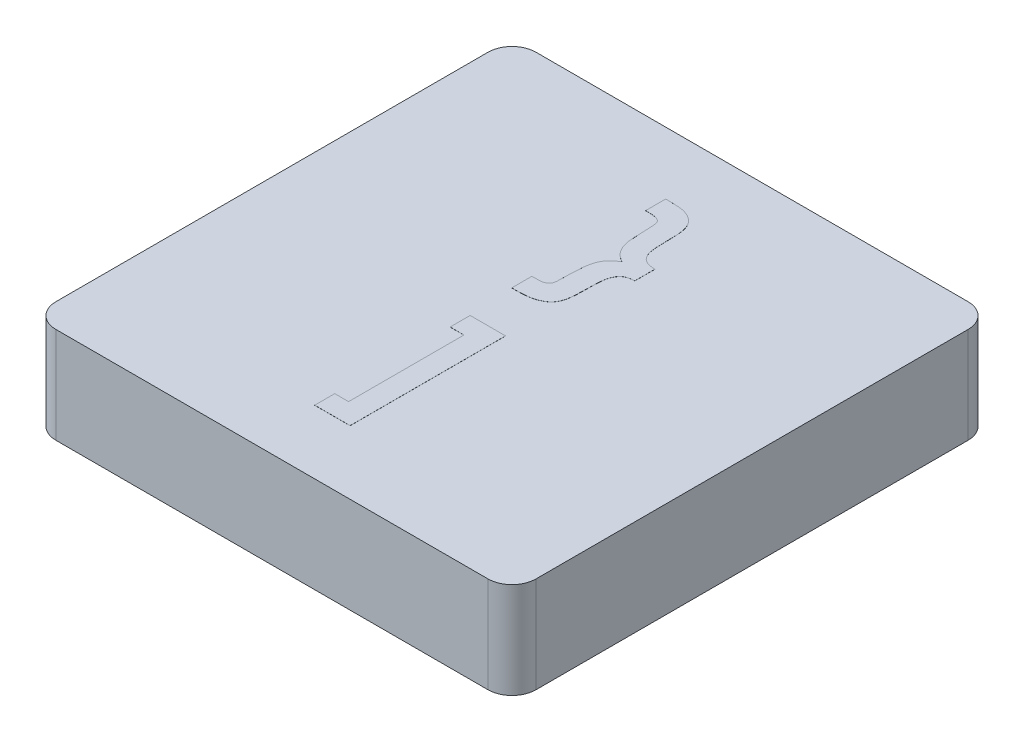
from build123d import *

# Parameters (mm, degrees)
SKETCH1_W           = 12.7
SKETCH1_H           = 12.7
BOSS_EXTRUDE1_DEPTH = 2.54
FILLET1_R           = 0.635
SHELL1_START        = 0.635
SHELL1_OUTLINE_W    = 1.905
SHELL1_OUTLINE_H    = 11.43
SHELL1_DEPTH        = 11.43
SKETCH2_R           = 2.54
BOSS_EXTRUDE2_DEPTH = 1.905
BOSS_EXTRUDE4_DEPTH = 0.00254


# Read off the part's stored shape, not the designer's step: Shell1
with BuildPart() as part:
    # Sketch1 → Boss-Extrude1 (new body)
    with BuildSketch(Plane(origin=(0, 0, 0), x_dir=(1, 0, 0), z_dir=(0, 1, 0))):
        with Locations((6.35, 6.35)):
            Rectangle(SKETCH1_W, SKETCH1_H)
    extrude(amount=BOSS_EXTRUDE1_DEPTH)

    # Fillet1
    fillet1_edges = [part.edges().sort_by_distance(p)[0] for p in [
        (0, 1.27, -12.7),
        (12.7, 1.27, -12.7),
        (12.7, 1.27, 0),
        (0, 1.27, 0),
    ]]
    fillet(fillet1_edges, radius=FILLET1_R)

    # Shell1 outline → Shell1 (cut)
    with BuildSketch(Plane.YZ.offset(SHELL1_START)):
        with Locations((0.9525, -6.35)):
            Rectangle(SHELL1_OUTLINE_W, SHELL1_OUTLINE_H)
    extrude(amount=SHELL1_DEPTH, mode=Mode.SUBTRACT)

    # Sketch2 → Boss-Extrude2 (add)
    with BuildSketch(Plane(origin=(0, 1.905, 0), x_dir=(-1, 0, 0), z_dir=(0, -1, 0))):
        with Locations(Location((-6.35, 6.35, 0), (0, 0, 270))):
            Circle(SKETCH2_R)
    extrude(amount=BOSS_EXTRUDE2_DEPTH)

    # Sketch4 → Boss-Extrude4 (add)
    with BuildSketch(Plane(origin=(0, 2.54, 0), x_dir=(1, 0, 0), z_dir=(0, 1, 0))):
        Polygon((6.732628205, 1.685192308), (5.796410256, 1.685192308), (5.796410256, 2.214358974), (6.16275641, 2.214358974), (6.16275641, 5.26724359), (5.796410256, 5.26724359), (5.796410256, 5.796410256), (6.732628205, 5.796410256), align=None)
        with BuildLine():
            Line((7.180384615, 9.298679487), (7.180384615, 8.769512821))
            add(Edge.make_bspline(
                [(7.180384615, 8.769512821), (7.152116937, 8.767117491), (7.099017873, 8.762618013), (7.0253764, 8.747759344), (6.963193844, 8.726027376), (6.911796647, 8.695840272), (6.870023551, 8.656558396), (6.833838845, 8.609026502), (6.803009788, 8.5518655), (6.781418088, 8.497365782), (6.767346169, 8.44716793), (6.757830159, 8.402799025), (6.75069662, 8.352150851), (6.743391897, 8.295819896), (6.738424945, 8.23320688), (6.735756394, 8.164671888), (6.732702366, 8.090058902), (6.732653587, 8.038308385), (6.732628205, 8.011379808)],
                knots=[0, 0, 0, 0, 1.34611932, 2.528600843, 3.557114667, 4.459936617, 5.336105306, 6.262193966, 7.284829814, 8.410061544, 9.037770113, 9.758356444, 10.562659162, 11.465312764, 12.455021506, 13.543269222, 14.721630887, 16, 16, 16, 16], degree=3))
            add(Edge.make_bspline(
                [(6.732628205, 8.011379808), (6.7325086, 7.977670399), (6.732279147, 7.913001774), (6.730484256, 7.820124139), (6.727043054, 7.73576107), (6.723840889, 7.659566997), (6.71768103, 7.591986149), (6.712004601, 7.532453336), (6.703476518, 7.481613244), (6.692177745, 7.425537894), (6.673404037, 7.364667483), (6.645479332, 7.298706381), (6.610999078, 7.24056771), (6.570338319, 7.18872446), (6.520267935, 7.144026013), (6.461108901, 7.103954563), (6.391961244, 7.067824919), (6.327106574, 7.041711283), (6.269365065, 7.023523736), (6.220329862, 7.011300854), (6.166771233, 7.001414815), (6.108380505, 6.993334893), (6.045868107, 6.986011018), (5.978343011, 6.982127408), (5.906480609, 6.978451149), (5.856837661, 6.978474969), (5.831391226, 6.978487179)],
                knots=[0, 0, 0, 0, 1.476292775, 2.832141699, 4.067875998, 5.174156026, 6.171124521, 7.03957686, 7.792094027, 8.427602841, 9.543696664, 10.575090094, 11.557556298, 12.495722216, 13.448793251, 14.484065917, 15.617899431, 16.859271456, 17.540541521, 18.267893864, 19.070951301, 19.924434812, 20.849274359, 21.826329424, 22.885800123, 24, 24, 24, 24], degree=3))
            Line((5.831391226, 6.978487179), (5.715, 6.978487179))
            Line((5.715, 6.978487179), (5.715, 7.507653846))
            add(Edge.make_bspline(
                [(5.715, 7.507653846), (5.733656322, 7.507887087), (5.769273166, 7.508332367), (5.820381404, 7.508638134), (5.86642757, 7.510362909), (5.907301349, 7.513892023), (5.94295882, 7.516855325), (5.973602064, 7.520374672), (5.999080838, 7.525446117), (6.025964191, 7.532875434), (6.054323226, 7.544739259), (6.084065636, 7.562365186), (6.108631288, 7.58457838), (6.12992865, 7.611248394), (6.145329605, 7.647034808), (6.155192091, 7.692920824), (6.162333621, 7.749760192), (6.162607424, 7.791501428), (6.16275641, 7.814214343)],
                knots=[0, 0, 0, 0, 1.374232214, 2.623551164, 3.764427832, 4.766850136, 5.644783718, 6.400149561, 7.037129969, 7.556205495, 8.45228239, 9.293190251, 10.089415762, 10.879647017, 11.788155005, 12.928176444, 14.328509846, 16, 16, 16, 16], degree=3))
            add(Edge.make_bspline(
                [(6.16275641, 7.814214343), (6.163249769, 7.86022185), (6.16426169, 7.954587199), (6.168592676, 8.099862764), (6.177052285, 8.252521511), (6.184841456, 8.356749617), (6.188833133, 8.410162861)],
                knots=[0, 0, 0, 0, 0.925341177, 1.897954219, 2.922775372, 4, 4, 4, 4], degree=3))
            add(Edge.make_bspline(
                [(6.188833133, 8.410162861), (6.192466078, 8.444854682), (6.19962681, 8.513234158), (6.224334129, 8.612025016), (6.258872426, 8.705540026), (6.291087372, 8.762678779), (6.307132412, 8.79113742)],
                knots=[0, 0, 0, 0, 1.038691334, 2.047317343, 3.027442997, 4, 4, 4, 4], degree=3))
            add(Edge.make_bspline(
                [(6.307132412, 8.79113742), (6.321972897, 8.812652533), (6.353108329, 8.857791377), (6.415610294, 8.918163806), (6.489134804, 8.979118523), (6.545410235, 9.015194232), (6.574895833, 9.034096154)],
                knots=[0, 0, 0, 0, 0.858630849, 1.801412987, 2.848046982, 4, 4, 4, 4], degree=3))
            add(Edge.make_bspline(
                [(6.574895833, 9.034096154), (6.549125071, 9.049053867), (6.49873184, 9.078302808), (6.429924013, 9.13026886), (6.369878367, 9.188503183), (6.317319103, 9.252783885), (6.273682009, 9.325227731), (6.238068597, 9.405969497), (6.21038513, 9.495839074), (6.199544841, 9.559496411), (6.193921274, 9.592519631)],
                knots=[0, 0, 0, 0, 1.014678051, 1.984144059, 2.92926972, 3.858918724, 4.805451336, 5.801520814, 6.85950519, 8, 8, 8, 8], degree=3))
            add(Edge.make_bspline(
                [(6.193921274, 9.592519631), (6.192829809, 9.601844471), (6.190153993, 9.624705073), (6.186428391, 9.665197739), (6.182711535, 9.718213802), (6.178967567, 9.78373166), (6.17515671, 9.861964905), (6.171594782, 9.952723814), (6.166871973, 10.055950683), (6.164180341, 10.128892026), (6.16275641, 10.167479567)],
                knots=[0, 0, 0, 0, 0.391231833, 0.959136639, 1.694336264, 2.605860501, 3.693829686, 4.958313784, 6.390882485, 8, 8, 8, 8], degree=3))
            add(Edge.make_bspline(
                [(6.16275641, 10.167479567), (6.161752892, 10.194852717), (6.159961412, 10.24371924), (6.154185328, 10.3081671), (6.148134503, 10.355593788), (6.139898145, 10.38039454), (6.136679687, 10.390085737)],
                knots=[0, 0, 0, 0, 1.460896676, 2.607991543, 3.456055673, 4, 4, 4, 4], degree=3))
            add(Edge.make_bspline(
                [(6.136679687, 10.390085737), (6.131421611, 10.400771062), (6.120902938, 10.42214683), (6.096351246, 10.449281447), (6.065948403, 10.471644445), (6.035884233, 10.48641756), (6.007349543, 10.496671396), (5.980188513, 10.502628944), (5.948029321, 10.507309063), (5.91125855, 10.51300137), (5.869139852, 10.515459524), (5.822310956, 10.518334298), (5.770336037, 10.519308312), (5.734079953, 10.519652305), (5.715, 10.519833333)],
                knots=[0, 0, 0, 0, 0.914847875, 1.830134071, 2.788379729, 3.812190628, 4.401778296, 5.123687592, 5.951697865, 6.909106018, 7.991445102, 9.203275882, 10.528209379, 12, 12, 12, 12], degree=3))
            Line((5.715, 10.519833333), (5.715, 11.049))
            Line((5.715, 11.049), (5.826303085, 11.049))
            add(Edge.make_bspline(
                [(5.826303085, 11.049), (5.850899164, 11.048953563), (5.89840989, 11.048863865), (5.967106444, 11.046052156), (6.030979134, 11.042555102), (6.089721785, 11.036788416), (6.143597486, 11.029763452), (6.192492657, 11.021777182), (6.236558877, 11.01183238), (6.28762469, 10.995474866), (6.34613688, 10.973444396), (6.409337268, 10.939159584), (6.466624044, 10.900361614), (6.517251388, 10.855637653), (6.561309946, 10.804623309), (6.597963954, 10.746974085), (6.628896111, 10.683522864), (6.648419107, 10.625284217), (6.6610103, 10.573319813), (6.668920876, 10.527159457), (6.676780817, 10.474846091), (6.682168847, 10.41580311), (6.686622355, 10.350276636), (6.689661408, 10.278169854), (6.691604989, 10.199503298), (6.691814074, 10.145008252), (6.691923077, 10.116598157)],
                knots=[0, 0, 0, 0, 1.16824548, 2.256627616, 3.265509467, 4.206460678, 5.059622585, 5.846041034, 6.559357146, 7.202780001, 8.392189823, 9.523072435, 10.609682644, 11.672655245, 12.722378573, 13.800649938, 14.908656622, 16.067882113, 16.710279592, 17.447094841, 18.29165442, 19.222582257, 20.262257832, 21.411422203, 22.650487615, 24, 24, 24, 24], degree=3))
            add(Edge.make_bspline(
                [(6.691923077, 10.116598157), (6.691946546, 10.08500566), (6.691991602, 10.024353303), (6.695037873, 9.937657564), (6.697604685, 9.858936679), (6.702994772, 9.788349999), (6.708746313, 9.725452017), (6.717435268, 9.670838427), (6.725569823, 9.624076247), (6.739969909, 9.57393931), (6.761752098, 9.520118175), (6.794076806, 9.46359394), (6.832821407, 9.415595854), (6.878538803, 9.374947719), (6.935901421, 9.343812165), (7.005415238, 9.320870485), (7.088418429, 9.305342587), (7.148301337, 9.301003973), (7.180384615, 9.298679487)],
                knots=[0, 0, 0, 0, 1.37160012, 2.633244812, 3.766414912, 4.790838266, 5.706786639, 6.507424146, 7.191647048, 7.765697994, 8.769102944, 9.705363469, 10.582321296, 11.437014573, 12.34361795, 13.394499247, 14.604059017, 16, 16, 16, 16], degree=3))
        make_face()
    extrude(amount=BOSS_EXTRUDE4_DEPTH)


solid = part.part
